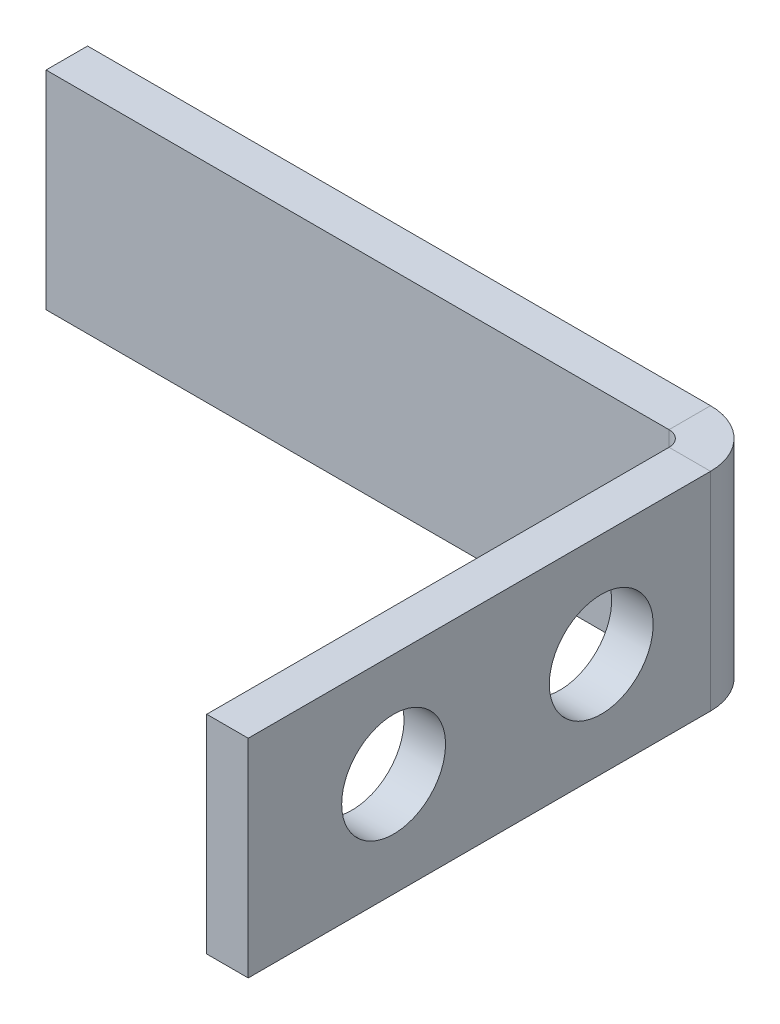
from build123d import *

# Parameters (mm, degrees)
SKETCH2_W          = 30
SKETCH2_H          = 10
BASE_FLANGE1_DEPTH = 2
EDGE_FLANGE1_DEPTH = 10
SKETCH10_R         = 2.5
CUT_EXTRUDE1_DEPTH = 39.713545169


# Sheet-metal steps are written as plain solids
with BuildPart() as part:
    # Sketch2 → Base-Flange1 (new body)
    with BuildSketch(Plane.XY):
        Rectangle(SKETCH2_W, SKETCH2_H)
    extrude(amount=-BASE_FLANGE1_DEPTH)

    # Edge-Flange1 section (across the edge) → Edge-Flange1 (add)
    with BuildSketch(Plane(origin=(15.7366, -5, 0), x_dir=(-1, 0, 0), z_dir=(0, 1, 0))):
        with BuildLine():
            Line((-2, 0.7366), (-2, 23))
            Line((-2, 23), (0, 23))
            Line((0, 23), (0, 0.7366))
            ThreePointArc((0, 0.7366), (0.215745145, 0.215745145), (0.7366, 0))
            Line((0.7366, 0), (0.7366, -2))
            ThreePointArc((0.7366, -2), (-1.198468417, -1.198468417), (-2, 0.7366))
        make_face()
    extrude(amount=EDGE_FLANGE1_DEPTH)

    # Sketch10 → Cut-Extrude1 (cut, through all)
    with BuildSketch(Plane.ZY.offset(-15.7366)):
        with Locations((6, 0)):
            Circle(SKETCH10_R)
        with Locations((16, 0)):
            Circle(SKETCH10_R)
    extrude(amount=-CUT_EXTRUDE1_DEPTH, mode=Mode.SUBTRACT)


solid = part.part
